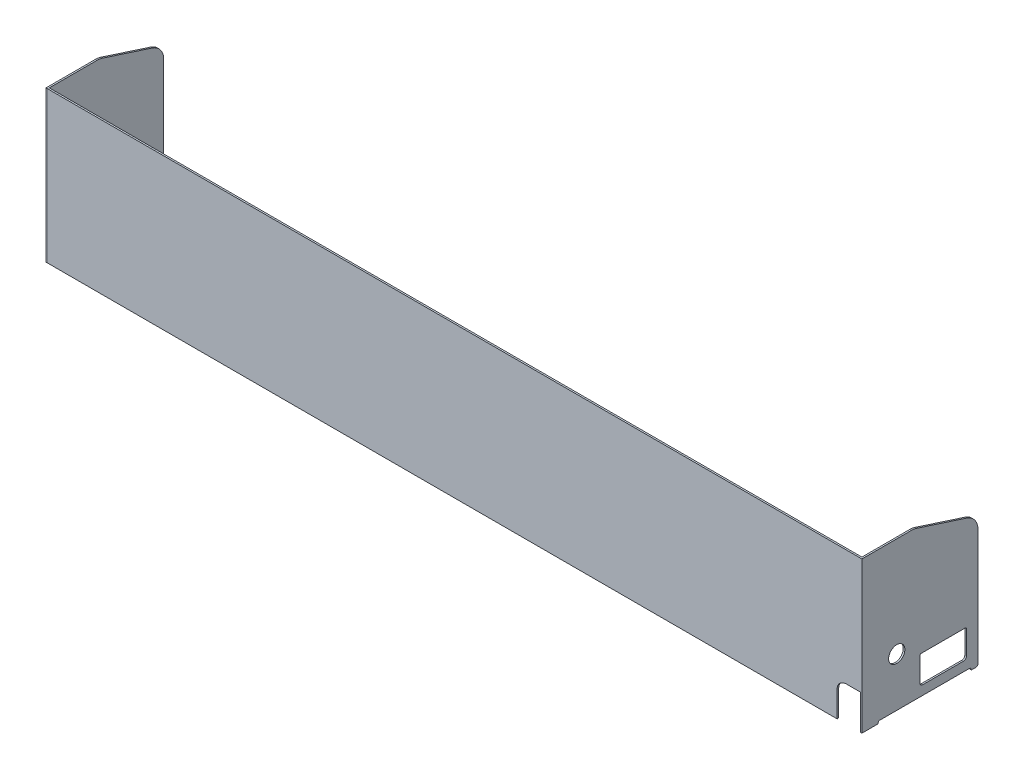
from build123d import *

# Parameters (mm, degrees)
BACK_WALL_DEPTH  = 0.7
SKETCH2_R        = 3.5
RIGHT_WALL_DEPTH = 0.7


with BuildPart() as part:
    # Sketch1 → Back Wall (new body)
    with BuildSketch(Plane.XY):
        with BuildLine():
            Line((175, -17.5), (169, -17.5))
            ThreePointArc((169, -17.5), (166.171572875, -18.671572875), (165, -21.5))
            Line((165, -21.5), (165, -32.5))
            Line((165, -32.5), (-175, -32.5))
            Line((-175, -32.5), (-175, 32.5))
            Line((-175, 32.5), (175, 32.5))
            Line((175, 32.5), (175, -17.5))
        make_face()
    extrude(amount=BACK_WALL_DEPTH)


with BuildPart() as body_2:
    # Sketch2 → Right Wall (new body)
    with BuildSketch(Plane.ZY.offset(175)):
        with BuildLine():
            Line((-48.3, -32.5), (-46.5, -32.5))
            ThreePointArc((-46.5, -32.5), (-46.358578644, -32.441421356), (-46.3, -32.3))
            Line((-46.3, -32.3), (-46.3, -32.2))
            ThreePointArc((-46.3, -32.2), (-46.094974747, -31.705025253), (-45.6, -31.5))
            Line((-45.6, -31.5), (-7, -31.5))
            ThreePointArc((-7, -31.5), (-6.505025253, -31.705025253), (-6.3, -32.2))
            Line((-6.3, -32.2), (-6.3, -32.3))
            ThreePointArc((-6.3, -32.3), (-6.241421356, -32.441421356), (-6.1, -32.5))
            Line((-6.1, -32.5), (0.7, -32.5))
            Line((0.7, -32.5), (0.7, 32.5))
            Line((0.7, 32.5), (-20.643340495, 32.5))
            ThreePointArc((-20.643340495, 32.5), (-21.733083601, 32.414655448), (-22.79625424, 32.160702846))
            Line((-22.79625424, 32.160702846), (-44.452913745, 25.160702846))
            ThreePointArc((-44.452913745, 25.160702846), (-47.959964497, 22.618835016), (-49.3, 18.5))
            Line((-49.3, 18.5), (-49.3, -31.5))
            ThreePointArc((-49.3, -31.5), (-49.007106781, -32.207106781), (-48.3, -32.5))
        make_face()
        with Locations((-14.3, -10.5)):
            Circle(SKETCH2_R, mode=Mode.SUBTRACT)
        with BuildLine():
            Line((-43.8, -15.5), (-24.8, -15.5))
            ThreePointArc((-24.8, -15.5), (-24.446446609, -15.646446609), (-24.3, -16))
            Line((-24.3, -16), (-24.3, -26.3))
            ThreePointArc((-24.3, -26.3), (-24.651471863, -27.148528137), (-25.5, -27.5))
            Line((-25.5, -27.5), (-43.1, -27.5))
            ThreePointArc((-43.1, -27.5), (-43.948528137, -27.148528137), (-44.3, -26.3))
            Line((-44.3, -26.3), (-44.3, -16))
            ThreePointArc((-44.3, -16), (-44.153553391, -15.646446609), (-43.8, -15.5))
        make_face(mode=Mode.SUBTRACT)
    right_wall = extrude(amount=RIGHT_WALL_DEPTH)


with BuildPart() as part_1:
    add(part.part)

    # Mirror8: Right Wall across plane
    add(right_wall.mirror(Plane(origin=(0, 0, 0), x_dir=(0, 0, 1), z_dir=(1, 0, 0))))


solid = Compound([body_2.part, part_1.part])
